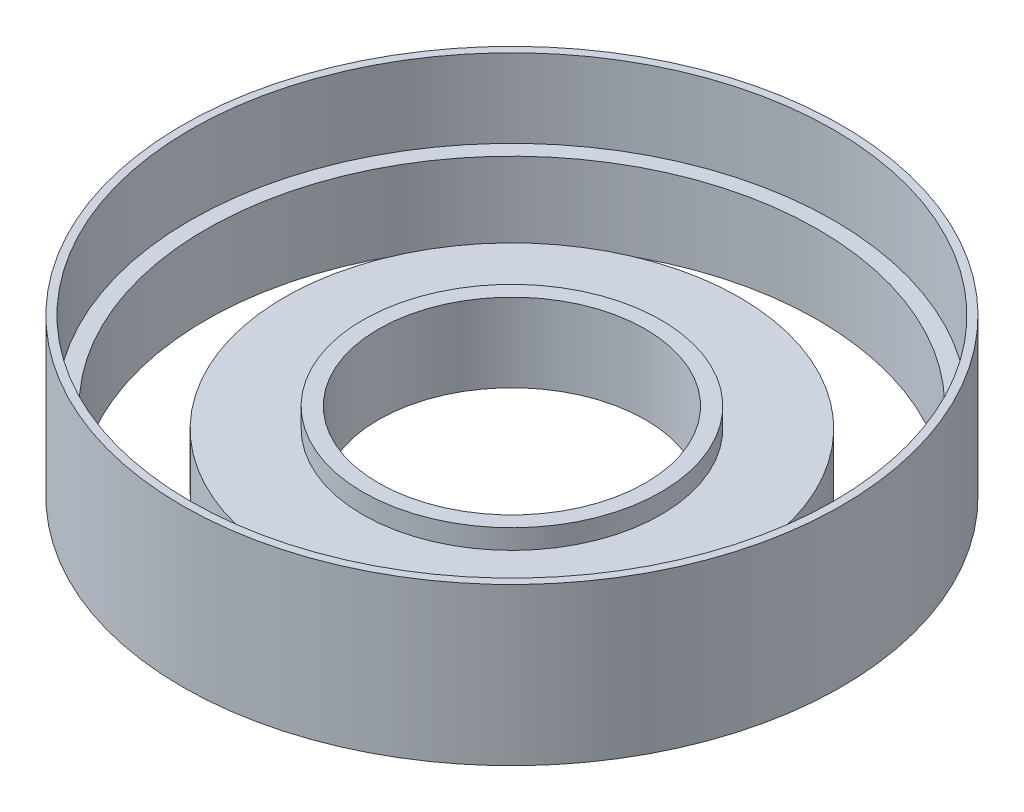
from build123d import *

# Parameters (mm, degrees)
SKETCH1_R           = 42
SKETCH1_R_2         = 41
BOSS_EXTRUDE1_DEPTH = 20
SKETCH1_3_R         = 41
SKETCH1_3_R_2       = 39
SKETCH1_3_R_3       = 19
SKETCH1_3_R_4       = 17
BOSS_EXTRUDE2_DEPTH = 10
SKETCH1_4_R         = 29
SKETCH1_4_R_2       = 19
BOSS_EXTRUDE3_DEPTH = 7.5


with BuildPart() as part:
    # Sketch1 → Boss-Extrude1 (new body)
    with BuildSketch(Plane(origin=(0, 0, 0), x_dir=(1, 0, 0), z_dir=(0, 1, 0))):
        Circle(SKETCH1_R)
        Circle(SKETCH1_R_2, mode=Mode.SUBTRACT)
    extrude(amount=BOSS_EXTRUDE1_DEPTH)

    # Sketch1<3> → Boss-Extrude2 (add)
    # profile 1 of 2: a face of its own
    with BuildSketch(Plane(origin=(0, 0, 0), x_dir=(1, 0, 0), z_dir=(0, 1, 0))):
        Circle(SKETCH1_3_R)
        Circle(SKETCH1_3_R_2, mode=Mode.SUBTRACT)
    # profile 2 of 2: a face of its own
    with BuildSketch(Plane(origin=(0, 0, 0), x_dir=(1, 0, 0), z_dir=(0, 1, 0))):
        Circle(SKETCH1_3_R_3)
        Circle(SKETCH1_3_R_4, mode=Mode.SUBTRACT)
    extrude(amount=BOSS_EXTRUDE2_DEPTH)


with BuildPart() as boss_extrude2_piece_1:
    # of the separate pieces the step leaves, piece 1, a body of its own (boss_extrude2_pieces)
    add(part.part.solids().sort_by_distance((42, 0, 0))[0])


with BuildPart() as boss_extrude2_piece_2:
    # of the separate pieces the step leaves, piece 2, a body of its own (boss_extrude2_pieces)
    add(part.part.solids().sort_by_distance((19, 0, 0))[0])

    # Sketch1<4> → Boss-Extrude3 (add)
    with BuildSketch(Plane(origin=(0, 0, 0), x_dir=(1, 0, 0), z_dir=(0, 1, 0))):
        Circle(SKETCH1_4_R)
        Circle(SKETCH1_4_R_2, mode=Mode.SUBTRACT)
    extrude(amount=BOSS_EXTRUDE3_DEPTH)


solid = Compound([boss_extrude2_piece_1.part, boss_extrude2_piece_2.part])
